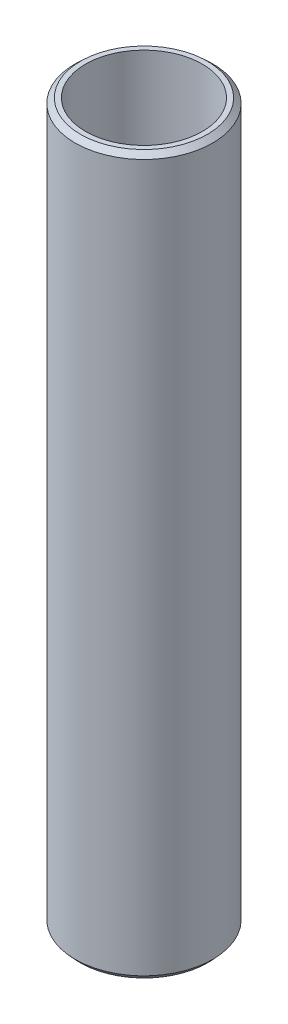
from build123d import *
from OCP.BRepFilletAPI import BRepFilletAPI_MakeChamfer

# Parameters (mm, degrees)
SKETCH1_R           = 57.5
BOSS_EXTRUDE1_DEPTH = 600
SKETCH2_R           = 48.869789171
CUT_EXTRUDE1_DEPTH  = 606.485342515
CHAMFER1_SIZE       = 4.073470785
CHAMFER1_SIZE2      = 4.44539108


with BuildPart() as part:
    # Sketch1 → Boss-Extrude1 (new body)
    with BuildSketch(Plane(origin=(0, 0, 0), x_dir=(1, 0, 0), z_dir=(0, 1, 0))):
        Circle(SKETCH1_R)
    extrude(amount=BOSS_EXTRUDE1_DEPTH)

    # Sketch2 → Cut-Extrude1 (cut, through all)
    with BuildSketch(Plane(origin=(0, 0, 0), x_dir=(1, 0, 0), z_dir=(0, 1, 0))):
        Circle(SKETCH2_R)
    extrude(amount=CUT_EXTRUDE1_DEPTH, mode=Mode.SUBTRACT)

    # Chamfer1: one chamfer whose edges measure the first distance from different faces: ONE call of the kernel's chamfer builder (chamfer() names one face for all edges)
    chamfer1_edges_1 = [part.edges().sort_by_distance(p)[0] for p in [
        (-57.5, 600, 0),
    ]]
    chamfer1_side_1 = [part.faces().sort_by_distance(p)[0] for p in [
        (-57.5, 300, 0),
    ]]
    chamfer1_edges_2 = [part.edges().sort_by_distance(p)[0] for p in [
        (-57.5, 0, 0),
    ]]
    chamfer1_side_2 = [part.faces().sort_by_distance(p)[0] for p in [
        (-55.873654403, 0, 0),
    ]]
    chamfer1 = BRepFilletAPI_MakeChamfer(part.part.solid().wrapped)
    for e in chamfer1_edges_1:
        chamfer1.Add(CHAMFER1_SIZE, CHAMFER1_SIZE2, e.wrapped, chamfer1_side_1[0].wrapped)  # the first distance lies on this face
    for e in chamfer1_edges_2:
        chamfer1.Add(CHAMFER1_SIZE, CHAMFER1_SIZE2, e.wrapped, chamfer1_side_2[0].wrapped)  # the first distance lies on this face
    add(Compound.cast(chamfer1.Shape()), mode=Mode.REPLACE)


solid = part.part
